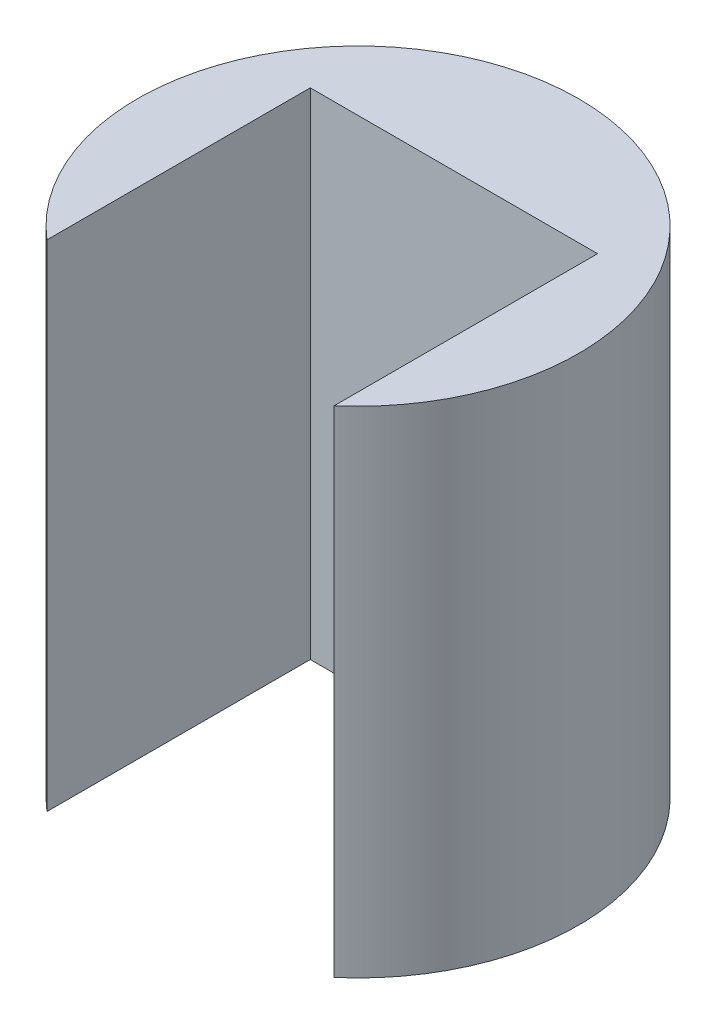
from build123d import *

# Parameters (mm, degrees)
BOSS_EXTRUDE2_DEPTH = 114


with BuildPart() as part:
    # Sketch1 → Boss-Extrude2 (new body)
    with BuildSketch(Plane(origin=(0, 0, 0), x_dir=(1, 0, 0), z_dir=(0, 1, 0))):
        with BuildLine():
            Line((-33.072674511, -38.559540981), (-33.072674511, 22.068059758))
            Line((-33.072674511, 22.068059758), (33.072674511, 22.068059758))
            Line((33.072674511, 22.068059758), (33.072674511, -38.559540981))
            ThreePointArc((33.072674511, -38.559540981), (0, 50.8), (-33.072674511, -38.559540981))
        make_face()
    extrude(amount=BOSS_EXTRUDE2_DEPTH)


solid = part.part
